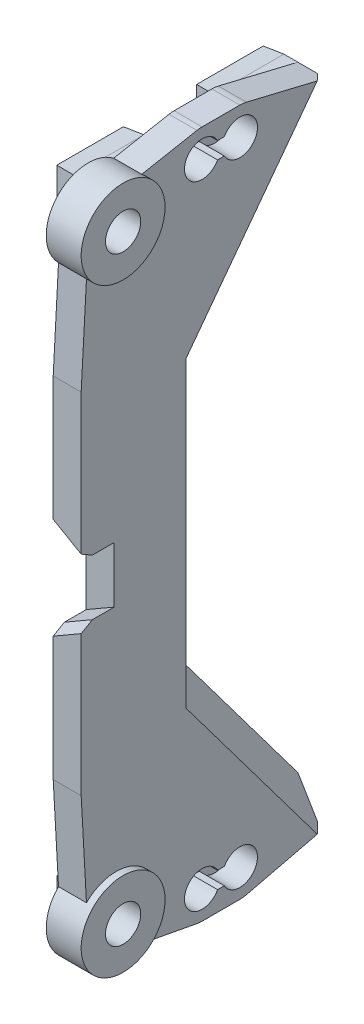
from build123d import *
from OCP.BRepFilletAPI import BRepFilletAPI_MakeChamfer

# Parameters (mm, degrees)
DOWELSUPPORT_DEPTH       = 1.905
DOWELSUPPORT_DEPTH_BACK  = 1.27
SKETCH3_R                = 3.81
SKETCH5_W                = 9.525
SKETCH5_H                = 31.75
SLIDERDOWELSUPPORT_DEPTH = 1.27
STRINGDOWELSUPPORT_DEPTH = 1.27
SKETCH9_W                = 6.35
SKETCH9_H                = 3
TABSUPPORT_DEPTH         = 1.27
INTERSUPPORT_DEPTH       = 1.27
DOWELHOLES_DEPTH         = 36.095686544
DOWELHOLES_DEPTH_BACK    = 36.095686544
SKETCH11_R               = 1.600000102
BOSS_EXTRUDE1_START      = -1.27
SKETCH11_2_R             = 1.600000102
BOSS_EXTRUDE1_DEPTH      = 0.254
SKETCH14_W               = 6.35
SKETCH14_H               = 3
TABBASE_DEPTH            = 1.27
SKETCH15_W               = 6.35
SKETCH15_H               = 3
TABDRAFT_DEPTH           = 1.73
TABDRAFT_DRAFT           = 5
TABDRAFT_PROFILE_2_DEPTH = 1.73
TABDRAFT_PROFILE_2_DRAFT = 5
CHAMFER2_SIZE            = 2.54
CUT_EXTRUDE1_DEPTH       = 3
CHAMFER3_SIZE            = 0.508
CHAMFER3_SIZE2           = 1.016


with BuildPart() as part:
    # Sketch3 → DowelSupport (new, two sides: drawn at the far end of the back side and taken through both)
    with BuildSketch(Plane(origin=(0, 0, 0), x_dir=(0, 0, -1), z_dir=(1, 0, 0)).offset(-DOWELSUPPORT_DEPTH_BACK)):
        with Locations((-3.175, 27.23375)):
            Circle(SKETCH3_R)
    extrude(amount=DOWELSUPPORT_DEPTH + DOWELSUPPORT_DEPTH_BACK)



with BuildPart() as body_2:
    # Sketch5 → SliderDowelSupport (new, symmetric)
    with BuildSketch(Plane(origin=(0, 0, 0), x_dir=(0, 0, -1), z_dir=(1, 0, 0))):
        with Locations((-1.5875, 0)):
            Rectangle(SKETCH5_W, SKETCH5_H)
    extrude(amount=SLIDERDOWELSUPPORT_DEPTH, both=True)


with BuildPart() as body_3:
    # Sketch8 → StringDowelSupport (new, symmetric)
    with BuildSketch(Plane(origin=(0, 0, 0), x_dir=(0, 0, -1), z_dir=(1, 0, 0))):
        with BuildLine():
            Line((4.6355, 31.242), (8.0645, 31.242))
            ThreePointArc((8.0645, 31.242), (10.6045, 28.702), (8.0645, 26.162))
            Line((8.0645, 26.162), (4.6355, 26.162))
            ThreePointArc((4.6355, 26.162), (2.0955, 28.702), (4.6355, 31.242))
        make_face()
    extrude(amount=STRINGDOWELSUPPORT_DEPTH, both=True)


with BuildPart() as part_1:
    add(part.part)

    add(body_3.part)  # TabSupport merges body 3
    # Sketch9 → TabSupport (add, symmetric)
    with BuildSketch(Plane(origin=(0, 0, 0), x_dir=(0, 0, -1), z_dir=(1, 0, 0))):
        with Locations((0, 27.94)):
            Rectangle(SKETCH9_W, SKETCH9_H)
        with Locations((12.7, 27.94)):
            Rectangle(SKETCH9_W, SKETCH9_H)
    extrude(amount=TABSUPPORT_DEPTH, both=True)


    add(body_2.part)  # InterSupport merges body 2
    # Sketch10 → InterSupport (add, symmetric)
    with BuildSketch(Plane(origin=(0, 0, 0), x_dir=(0, 0, -1), z_dir=(1, 0, 0))):
        Polygon((-6.35, 15.875), (-5.711088789, 27.374652996), (-3.644260291, 29.730026182), (4.166239709, 31.198276182), (8.657140431, 31.171894192), (15.875, 29.44), (15.875, 26.44), (3.175, 9.525), (3.175, 15.875), align=None)
    extrude(amount=INTERSUPPORT_DEPTH, both=True)

    # Sketch11 → DowelHoles (cut, two sides: drawn at the far end of the back side and taken through both)
    with BuildSketch(Plane(origin=(0, 0, 0), x_dir=(0, 0, -1), z_dir=(1, 0, 0)).offset(-DOWELHOLES_DEPTH_BACK)):
        with Locations((-3.175, 27.23375)):
            Circle(SKETCH11_R)
        with BuildLine():
            Line((6.04239599, 27.94), (6.65760401, 27.94))
            ThreePointArc((6.65760401, 27.94), (9.664500102, 28.702), (6.65760401, 29.464))
            Line((6.65760401, 29.464), (6.04239599, 29.464))
            ThreePointArc((6.04239599, 29.464), (3.035499898, 28.702), (6.04239599, 27.94))
        make_face()
    extrude(amount=DOWELHOLES_DEPTH + DOWELHOLES_DEPTH_BACK, mode=Mode.SUBTRACT)

    # Sketch11<2> → Boss-Extrude1 (add)
    with BuildSketch(Plane(origin=(0, 0, 0), x_dir=(0, 0, -1), z_dir=(1, 0, 0)).offset(BOSS_EXTRUDE1_START)):
        with BuildLine():
            Line((6.04239599, 27.94), (6.65760401, 27.94))
            ThreePointArc((6.65760401, 27.94), (9.664500102, 28.702), (6.65760401, 29.464))
            Line((6.65760401, 29.464), (6.04239599, 29.464))
            ThreePointArc((6.04239599, 29.464), (3.035499898, 28.702), (6.04239599, 27.94))
        make_face()
        with Locations((-3.175, 27.23375)):
            Circle(SKETCH11_2_R)
    extrude(amount=BOSS_EXTRUDE1_DEPTH)

    # Sketch14 → TabBase (add)
    with BuildSketch(Plane.ZY.offset(1.27)):
        with Locations((-12.7, 27.94)):
            Rectangle(SKETCH14_W, SKETCH14_H)
        with Locations((0, 27.94)):
            Rectangle(SKETCH14_W, SKETCH14_H)
    extrude(amount=TABBASE_DEPTH)


with BuildPart() as tabdraft_tool:
    # Sketch15 → TabDraft (with draft: the straight prism first)
    with BuildSketch(Plane.ZY.offset(2.54)):
        with Locations((0, 27.94)):
            Rectangle(SKETCH15_W, SKETCH15_H)
    extrude(amount=TABDRAFT_DEPTH)
    # TabDraft: the draft: its side faces are tilted about the plane it starts from
    tabdraft_sides = [tabdraft_tool.faces().sort_by_distance(p)[0] for p in [
        (-3.405, 27.94, -3.175),
        (-3.405, 26.44, 0),
        (-3.405, 27.94, 3.175),
        (-3.405, 29.44, 0),
    ]]
    draft(tabdraft_sides, Plane.ZY.offset(2.54), TABDRAFT_DRAFT)


with BuildPart() as part_2:
    add(part_1.part)

    # TabDraft: add tabdraft_tool
    add(tabdraft_tool.part)


with BuildPart() as tabdraft_profile_2_tool:
    # Sketch15 → TabDraft profile 2 (with draft: the straight prism first)
    with BuildSketch(Plane.ZY.offset(2.54)):
        with Locations((-12.7, 27.94)):
            Rectangle(SKETCH15_W, SKETCH15_H)
    extrude(amount=TABDRAFT_PROFILE_2_DEPTH)
    # TabDraft profile 2: the draft: its side faces are tilted about the plane it starts from
    tabdraft_profile_2_sides = [tabdraft_profile_2_tool.faces().sort_by_distance(p)[0] for p in [
        (-3.405, 27.94, -15.875),
        (-3.405, 26.44, -12.7),
        (-3.405, 27.94, -9.525),
        (-3.405, 29.44, -12.7),
    ]]
    draft(tabdraft_profile_2_sides, Plane.ZY.offset(2.54), TABDRAFT_PROFILE_2_DRAFT)


with BuildPart() as part_3:
    add(part_2.part)

    # TabDraft profile 2: add tabdraft_profile_2_tool
    add(tabdraft_profile_2_tool.part)

    # Chamfer2
    chamfer2_edges = [part_3.edges().sort_by_distance(p)[0] for p in [
        (1.27, 17.9825, -9.525),
    ]]
    chamfer(chamfer2_edges, length=CHAMFER2_SIZE - 0.0001)  # a hair under: the kernel refuses the full size

    # Mirror1: part across plane


with BuildPart() as part_4:
    add(part_3.part)
    add(part_3.part.mirror(Plane.ZX))

    # Sketch16 → Cut-Extrude1 (cut)
    with BuildSketch(Plane.XY.offset(6.35)):
        Polygon((-1.27, 4.006469684), (-1.27, -4.006469684), (1.27, -2.54), (1.27, 2.54), align=None)
    extrude(amount=-CUT_EXTRUDE1_DEPTH, mode=Mode.SUBTRACT)

    # Chamfer3: one chamfer whose edges measure the first distance from different faces: ONE call of the kernel's chamfer builder (chamfer() names one face for all edges)
    chamfer3_edges_1 = [part_4.edges().sort_by_distance(p)[0] for p in [
        (0, 3.273234842, 6.35),
    ]]
    chamfer3_side_1 = [part_4.faces().sort_by_distance(p)[0] for p in [
        (0.024631688, 9.567006865, 6.35),
    ]]
    chamfer3_edges_2 = [part_4.edges().sort_by_distance(p)[0] for p in [
        (0, -3.273234842, 6.35),
    ]]
    chamfer3_side_2 = [part_4.faces().sort_by_distance(p)[0] for p in [
        (0.024631688, -9.567006865, 6.35),
    ]]
    chamfer3 = BRepFilletAPI_MakeChamfer(part_4.part.solid().wrapped)
    for e in chamfer3_edges_1:
        chamfer3.Add(CHAMFER3_SIZE, CHAMFER3_SIZE2, e.wrapped, chamfer3_side_1[0].wrapped)  # the first distance lies on this face
    for e in chamfer3_edges_2:
        chamfer3.Add(CHAMFER3_SIZE, CHAMFER3_SIZE2, e.wrapped, chamfer3_side_2[0].wrapped)  # the first distance lies on this face
    add(Compound.cast(chamfer3.Shape()), mode=Mode.REPLACE)


solid = part_4.part
